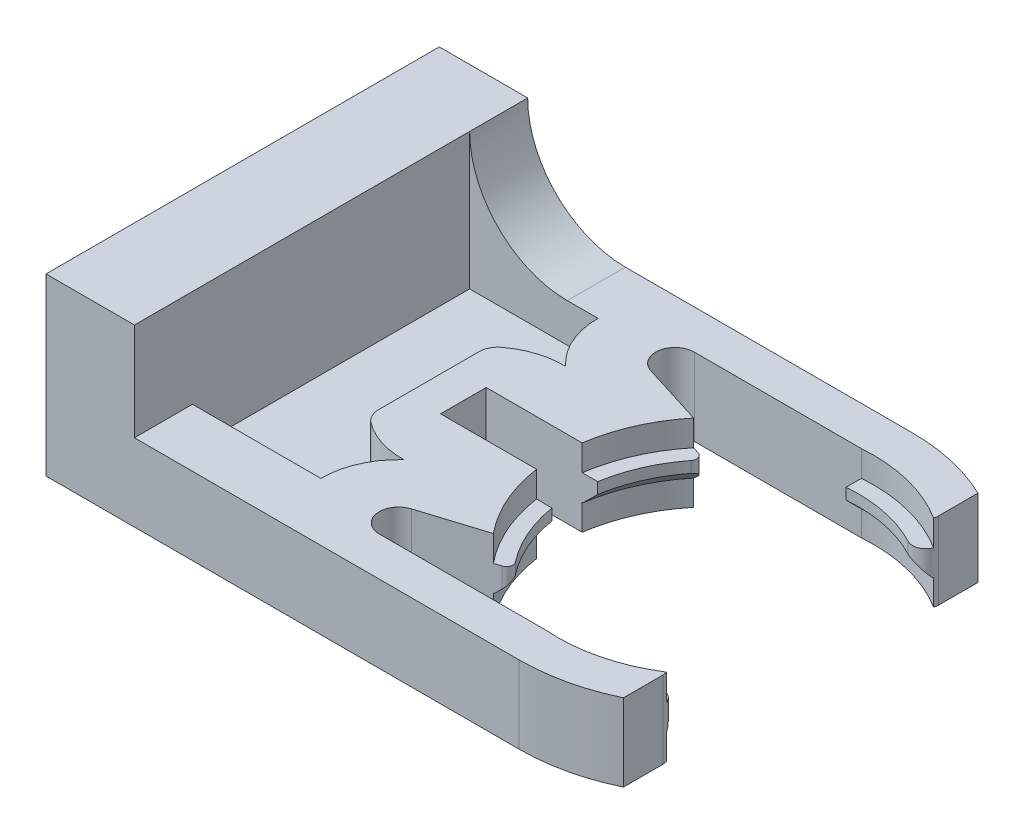
from build123d import *

# Parameters (mm, degrees)
BOSS_EXTRUDE1_DEPTH             = 4
SKETCH2_W                       = 7.077783737
SKETCH2_H                       = 4
CUT_EXTRUDE1_DEPTH              = 2.402922374
BOSS_EXTRUDE2_START             = 4
BOSS_EXTRUDE2_DEPTH             = 4
SKETCH4_W                       = 7.077783737
SKETCH4_H                       = 8
CUT_EXTRUDE2_DEPTH              = 14.891763442
BOSS_EXTRUDE3_DEPTH             = 4
CUT_EXTRUDE3_DEPTH              = 6
SCALE1_SCALE                    = 0.6
SCALE2_SCALE                    = 1.1
CHAMFER2_ANGLE                  = 32.170804
CHAMFER3_ANGLE                  = 32.170804
CHAMFER4_ANGLE                  = 37.089833
SKETCH9_W                       = 9.052660039
SKETCH9_H                       = 40.26
BOSS_EXTRUDE4_DEPTH             = 10
BOSS_EXTRUDE4_DIRECTION_2_REACH = 42.714
FILLET1_R                       = 10


with BuildPart() as part:
    # Sketch1 → Boss-Extrude1 (new body)
    with BuildSketch(Plane(origin=(0, 2, 0), x_dir=(1, 0, 0), z_dir=(0, 1, 0))):
        with BuildLine():
            Line((17.294685816, -3.533576913), (17.294685816, 3.544206824))
            ThreePointArc((17.294685816, 3.544206824), (18.863114644, 8.869467938), (21.707787317, 13.636669664))
            ThreePointArc((21.707787317, 13.636669664), (21.87503123, 14.549681712), (21.219564158, 15.2068913))
            Line((21.219564158, 15.2068913), (10.486342132, 18.5754084))
            ThreePointArc((10.486342132, 18.5754084), (8.419274676, 21.892156447), (11.384661403, 24.437754026))
            Line((11.384661403, 24.437754026), (37.31661015, 24.437754026))
            Line((37.31661015, 24.437754026), (37.327723934, 22.056391914))
            ThreePointArc((37.327723934, 22.056391914), (43.539057979, 21.687528752), (49.402053126, 19.603777671))
            ThreePointArc((49.402053126, 19.603777671), (51.365484655, 19.664217825), (52.33016375, 21.37539012))
            Line((52.33016375, 21.37539012), (52.33016375, 27.503190326))
            ThreePointArc((52.33016375, 27.503190326), (45.90109867, 29.745314945), (39.134829344, 30.505314955))
            Line((39.134829344, 30.505314955), (-34.24156443, 30.505314955))
            Line((-34.24156443, 30.505314955), (-34.24156443, -30.494685045))
            Line((-34.24156443, -30.494685045), (39.134829344, -30.494685045))
            ThreePointArc((39.134829344, -30.494685045), (45.90109867, -29.734685035), (52.33016375, -27.492560416))
            Line((52.33016375, -27.492560416), (52.33016375, -21.36476021))
            ThreePointArc((52.33016375, -21.36476021), (51.365484655, -19.653587914), (49.402053126, -19.593147761))
            ThreePointArc((49.402053126, -19.593147761), (43.533593788, -21.678008046), (37.31661015, -22.044848399))
            Line((37.31661015, -22.044848399), (37.31661015, -24.427124116))
            Line((37.31661015, -24.427124116), (11.384661403, -24.427124116))
            ThreePointArc((11.384661403, -24.427124116), (8.419274676, -21.881526536), (10.486342132, -18.564778489))
            Line((10.486342132, -18.564778489), (21.219564158, -15.19626139))
            ThreePointArc((21.219564158, -15.19626139), (21.87503123, -14.539051801), (21.707787317, -13.626039753))
            ThreePointArc((21.707787317, -13.626039753), (18.863114644, -8.858838027), (17.294685816, -3.533576913))
        make_face()
    extrude(amount=-BOSS_EXTRUDE1_DEPTH)

    # Sketch2 → Cut-Extrude1 (cut)
    with BuildSketch(Plane(origin=(17.294685816, 0, 0), x_dir=(0, 0, -1), z_dir=(1, 0, 0))):
        with Locations((0.005314956, 0)):
            Rectangle(SKETCH2_W, SKETCH2_H)
    extrude(amount=-CUT_EXTRUDE1_DEPTH, mode=Mode.SUBTRACT)

    # Sketch3 → Boss-Extrude2 (add)
    with BuildSketch(Plane(origin=(0, 2, 0), x_dir=(-1, 0, 0), z_dir=(0, 1, 0)).offset(BOSS_EXTRUDE2_START)):
        with BuildLine():
            Line((-14.891763442, -3.544206824), (-14.891763442, 3.533576913))
            ThreePointArc((-14.891763442, 3.533576913), (-16.721112086, 9.887878597), (-20.183130277, 15.52153606))
            Line((-20.183130277, 15.52153606), (-10.486342132, 18.564778489))
            ThreePointArc((-10.486342132, 18.564778489), (-8.419274676, 21.881526536), (-11.384661403, 24.427124116))
            Line((-11.384661403, 24.427124116), (-37.31661015, 24.427124116))
            ThreePointArc((-37.31661015, 24.427124116), (-45.066931496, 23.76567922), (-52.219299017, 20.708126414))
            ThreePointArc((-52.219299017, 20.708126414), (-52.302252812, 21.031796649), (-52.33016375, 21.36476021))
            Line((-52.33016375, 21.36476021), (-52.33016375, 27.492560416))
            ThreePointArc((-52.33016375, 27.492560416), (-45.90109867, 29.734685035), (-39.134829344, 30.494685045))
            Line((-39.134829344, 30.494685045), (34.241565294, 30.494685045))
            Line((34.241565294, 30.494685045), (34.241565294, -30.505314955))
            Line((34.241565294, -30.505314955), (-39.134829344, -30.505314955))
            ThreePointArc((-39.134829344, -30.505314955), (-45.90109867, -29.745314945), (-52.33016375, -27.503190326))
            Line((-52.33016375, -27.503190326), (-52.33016375, -21.37539012))
            ThreePointArc((-52.33016375, -21.37539012), (-52.302252812, -21.04242656), (-52.219299017, -20.718756325))
            ThreePointArc((-52.219299017, -20.718756325), (-45.066931496, -23.77630913), (-37.31661015, -24.437754026))
            Line((-37.31661015, -24.437754026), (-11.384661403, -24.437754026))
            ThreePointArc((-11.384661403, -24.437754026), (-8.419274676, -21.892156447), (-10.486342132, -18.5754084))
            Line((-10.486342132, -18.5754084), (-20.183130277, -15.53216597))
            ThreePointArc((-20.183130277, -15.53216597), (-16.721112086, -9.898508508), (-14.891763442, -3.544206824))
        make_face()
    extrude(amount=-BOSS_EXTRUDE2_DEPTH)

    # Sketch4 → Cut-Extrude2 (cut)
    with BuildSketch(Plane(origin=(14.891763442, 0, 0), x_dir=(0, 0, -1), z_dir=(1, 0, 0))):
        with Locations((0.005314956, 2)):
            Rectangle(SKETCH4_W, SKETCH4_H)
    extrude(amount=-CUT_EXTRUDE2_DEPTH, mode=Mode.SUBTRACT)

    # Sketch5 → Boss-Extrude3 (add)
    with BuildSketch(Plane.XZ.offset(2)):
        with BuildLine():
            Line((37.31661015, 24.427124116), (11.384661403, 24.427124116))
            ThreePointArc((11.384661403, 24.427124116), (8.419274676, 21.881526536), (10.486342132, 18.564778489))
            Line((10.486342132, 18.564778489), (20.183130277, 15.52153606))
            ThreePointArc((20.183130277, 15.52153606), (16.721112086, 9.887878597), (14.891763442, 3.533576913))
            Line((14.891763442, 3.533576913), (0, 3.533576913))
            Line((0, 3.533576913), (0, -3.544206824))
            Line((0, -3.544206824), (14.891763442, -3.544206824))
            ThreePointArc((14.891763442, -3.544206824), (16.721112086, -9.898508508), (20.183130277, -15.53216597))
            Line((20.183130277, -15.53216597), (10.486342132, -18.5754084))
            ThreePointArc((10.486342132, -18.5754084), (8.419274676, -21.892156447), (11.384661403, -24.437754026))
            Line((11.384661403, -24.437754026), (37.31661015, -24.437754026))
            ThreePointArc((37.31661015, -24.437754026), (45.066931496, -23.77630913), (52.219299017, -20.718756325))
            ThreePointArc((52.219299017, -20.718756325), (52.302252812, -21.04242656), (52.33016375, -21.37539012))
            Line((52.33016375, -21.37539012), (52.33016375, -27.503190326))
            ThreePointArc((52.33016375, -27.503190326), (45.90109867, -29.745314945), (39.134829344, -30.505314955))
            Line((39.134829344, -30.505314955), (-34.241565294, -30.505314955))
            Line((-34.241565294, -30.505314955), (-34.241565294, 30.494685045))
            Line((-34.241565294, 30.494685045), (39.134829344, 30.494685045))
            ThreePointArc((39.134829344, 30.494685045), (45.90109867, 29.734685035), (52.33016375, 27.492560416))
            Line((52.33016375, 27.492560416), (52.33016375, 21.36476021))
            ThreePointArc((52.33016375, 21.36476021), (52.302252812, 21.031796649), (52.219299017, 20.708126414))
            ThreePointArc((52.219299017, 20.708126414), (45.066931496, 23.76567922), (37.31661015, 24.427124116))
        make_face()
    extrude(amount=BOSS_EXTRUDE3_DEPTH)

    # Sketch6 → Cut-Extrude3 (cut)
    with BuildSketch(Plane(origin=(0, 6, 0), x_dir=(-1, 0, 0), z_dir=(0, 1, 0))):
        with BuildLine():
            Line((34.241565294, 21.494683919), (0.615148415, 21.494683919))
            ThreePointArc((0.615148415, 21.494683919), (-0.40252933, 16.590516303), (-3.333426268, 12.528943807))
            ThreePointArc((-3.333426268, 12.528943807), (0.609678883, 11.977798965), (4.155422589, 10.166848817))
            ThreePointArc((4.155422589, 10.166848817), (5.046731763, 9.106387113), (5.366566942, 7.758530841))
            Line((5.366566942, 7.758530841), (5.366566942, -7.769160752))
            ThreePointArc((5.366566942, -7.769160752), (5.046731763, -9.117017023), (4.155422589, -10.177478728))
            ThreePointArc((4.155422589, -10.177478728), (0.609678883, -11.988428875), (-3.333426268, -12.539573718))
            ThreePointArc((-3.333426268, -12.539573718), (-0.402529103, -16.601146729), (0.615148409, -21.505314955))
            Line((0.615148409, -21.505314955), (34.241565294, -21.505314955))
            Line((34.241565294, -21.505314955), (34.241565294, 21.494683919))
        make_face()
    extrude(amount=-CUT_EXTRUDE3_DEPTH, mode=Mode.SUBTRACT)


with BuildPart() as part_1:
    # Scale1: scaled about (-0.143748337, -0.76143553, -0.005277361)
    add(part.part.scale(SCALE1_SCALE).moved(Location((-0.057499335, -0.304574212, -0.002110944))))


with BuildPart() as part_2:
    # Scale2: scaled about (-0.143748337, -0.76143553, -0.005277361)
    add(part_1.part.scale(SCALE2_SCALE).moved(Location((0.014374834, 0.076143553, 0.000527736))))

    # Chamfer2: read off the stored shape, not the designer's step
    # Chamfer2 outline → Chamfer2 (revolve, cut)
    with BuildSketch(Plane(origin=(25.780112964, 0, -0.005302173), x_dir=(-0.9894243177123465, 0, 0.14505005866754295), z_dir=(-0.14505005866754295, 0, -0.9894243177123465))):
        Polygon((16.1025, -1.578888079), (14.602499776, -0.078887855), (14.602499776, -1.578888079), align=None)
    revolve(axis=Axis((25.780112964, 0, -0.005302173), (0, 1, 0)), revolution_arc=CHAMFER2_ANGLE, mode=Mode.SUBTRACT)

    # Chamfer3: read off the stored shape, not the designer's step
    # Chamfer3 outline → Chamfer3 (revolve, cut)
    with BuildSketch(Plane(origin=(25.780112964, 0, -0.005302173), x_dir=(-0.7602814738740017, 0, -0.6495937811309278), z_dir=(0.6495937811309278, 0, -0.7602814738740017))):
        Polygon((16.1025, -1.578888079), (14.602499776, -0.078887855), (14.602499776, -1.578888079), align=None)
    revolve(axis=Axis((25.780112964, 0, -0.005302173), (0, 1, 0)), revolution_arc=CHAMFER3_ANGLE, mode=Mode.SUBTRACT)

    # Chamfer4: read off the stored shape, not the designer's step
    # Chamfer4 outline → Chamfer4 (revolve, cut)
    with BuildSketch(Plane(origin=(25.780112964, 0, -0.005302173), x_dir=(0.5358984482336857, 0, -0.8442824486987324), z_dir=(0.8442824486987324, 0, 0.5358984482336857))):
        Polygon((16.1025, -1.578888079), (14.602495102, -0.078883181), (14.602495102, -1.578888079), align=None)
    revolve(axis=Axis((25.780112964, 0, -0.005302173), (0, 1, 0)), revolution_arc=CHAMFER4_ANGLE, mode=Mode.SUBTRACT)

    # Chamfer5: read off the stored shape, not the designer's step
    # Chamfer5 outline → Chamfer5 (revolve, cut)
    with BuildSketch(Plane(origin=(25.780112964, 0, -0.005302173), x_dir=(1, 0, 0), z_dir=(0, 0, 1))):
        Polygon((16.1025, -1.578888079), (14.602495102, -0.078883181), (14.602495102, -1.578888079), align=None)
    revolve(axis=Axis((25.780112964, 0, -0.005302173), (0, 1, 0)), mode=Mode.SUBTRACT)

    # Sketch9 → Boss-Extrude4 (add)
    with BuildSketch(Plane(origin=(0, 3.701111921, 0), x_dir=(1, 0, 0), z_dir=(0, 1, 0))):
        with Locations((-18.121977477, 0.005302173)):
            Rectangle(SKETCH9_W, SKETCH9_H)
    extrude(amount=BOSS_EXTRUDE4_DEPTH)

    # Boss-Extrude4 direction 2: up to this face of the body (flat: up to its plane)
    boss_extrude4_direction_2_end = Plane(part_2.part.faces().sort_by_distance((-12.071218374, -0.25888808, -0.005302566))[0])
    # Sketch9 → Boss-Extrude4 direction 2 (add, up to the picked face)
    with BuildSketch(Plane(origin=(0, 3.701111921, 0), x_dir=(1, 0, 0), z_dir=(0, 1, 0)), mode=Mode.PRIVATE) as boss_extrude4_direction_2_sk1:
        with Locations((-18.121977477, 0.005302173)):
            Rectangle(SKETCH9_W, SKETCH9_H)
    boss_extrude4_direction_2_tool1 = split(extrude(boss_extrude4_direction_2_sk1.sketch, amount=-BOSS_EXTRUDE4_DIRECTION_2_REACH, mode=Mode.PRIVATE), bisect_by=boss_extrude4_direction_2_end, keep=Keep.BOTH, mode=Mode.PRIVATE)
    add(boss_extrude4_direction_2_tool1.solids().sort_by(Axis((-18.121977, 3.701112, -0.005302), (0, -1, 0)))[0])

    # Fillet1
    fillet1_edges = [part_2.edges().sort_by_distance(p)[0] for p in [
        (-13.595647458, 3.701111921, -17.165302173),
    ]]
    fillet(fillet1_edges, radius=FILLET1_R - 0.0001)  # a hair under: the kernel refuses the full size


solid = part_2.part
